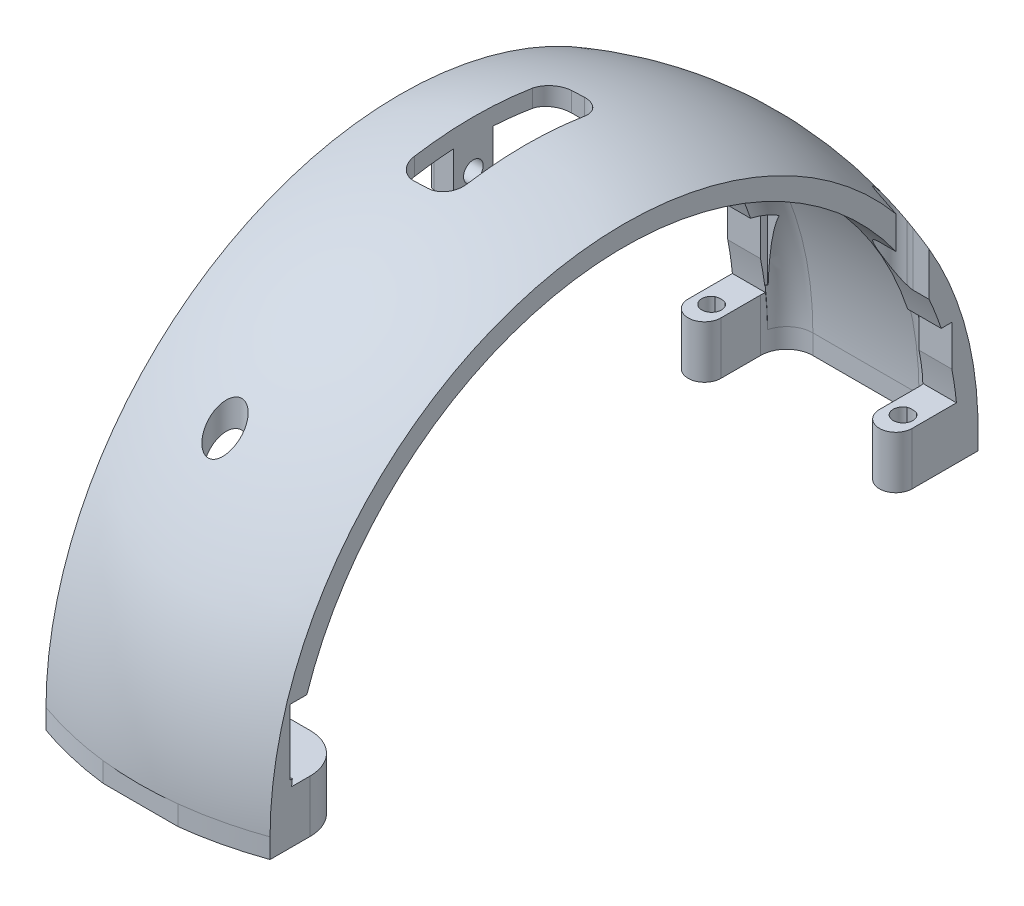
from build123d import *

# Parameters (mm, degrees)
BOSS_EXTRUDE1_DEPTH      = 2
REVOLVE6_ANGLE           = 180
CUT_EXTRUDE1_START       = 20.742633116
CUT_EXTRUDE1_OUTLINE_R   = 2.5
CUT_EXTRUDE1_DEPTH       = 21.257366884
BOSS_EXTRUDE2_DEPTH      = 2
BOSS_EXTRUDE2_DEPTH_BACK = 3
SKETCH1_11_R             = 1.5
BOSS_EXTRUDE3_START      = -3
SKETCH1_12_R             = 1.5
BOSS_EXTRUDE3_DEPTH      = 3
CUT_EXTRUDE2_DEPTH       = 70
BOSS_EXTRUDE5_START      = 47
BOSS_EXTRUDE5_DEPTH      = 7.045906413
SKETCH4_R                = 1.5
CUT_EXTRUDE3_DEPTH       = 16
CUT_EXTRUDE4_START       = -16
SKETCH4_3_R              = 1.5
CUT_EXTRUDE4_DEPTH       = 3
CUT_EXTRUDE5_START       = 6
SKETCH1_16_W             = 5
SKETCH1_16_H             = 2.29
CUT_EXTRUDE5_DEPTH       = 10
BOSS_EXTRUDE6_START      = 2
SKETCH1_17_R             = 1.5
BOSS_EXTRUDE6_DEPTH      = 3
BOSS_EXTRUDE7_START      = 12.7
BOSS_EXTRUDE7_DEPTH      = 12.7
BOSS_EXTRUDE8_DEPTH      = 16.51
BOSS_EXTRUDE9_DEPTH      = 3
CUT_EXTRUDE6_DEPTH       = 4
BOSS_EXTRUDE10_DEPTH     = 3
CUT_EXTRUDE8_REACH       = 81.497
CUT_EXTRUDE9_REACH       = 81.497
FILLET8_R                = 6


with BuildPart() as part:
    # Sketch1 → Boss-Extrude1 (new body)
    with BuildSketch(Plane(origin=(0, 0, 0), x_dir=(1, 0, 0), z_dir=(0, 1, 0))):
        with BuildLine():
            ThreePointArc((14.01, 44), (16.51, 41.5), (19.01, 44))
            Line((19.01, 44), (19.01, 54.045906413))
            add(Edge.make_bspline(
                [(-15.2, 54.045906413), (1.905, 60.045906413), (19.01, 54.045906413)],
                knots=[0, 0, 0, 1, 1, 1], degree=2))
            Line((-15.2, 54.045906413), (-15.2, 44))
            ThreePointArc((-15.2, 44), (-12.7, 41.5), (-10.2, 44))
            Line((-10.2, 44), (-10.2, 50.045906413))
            ThreePointArc((-10.2, 50.045906413), (-9.028427125, 52.874333538), (-6.2, 54.045906413))
            Line((-6.2, 54.045906413), (10.01, 54.045906413))
            ThreePointArc((10.01, 54.045906413), (12.838427125, 52.874333538), (14.01, 50.045906413))
            Line((14.01, 50.045906413), (14.01, 44))
        make_face()
        with BuildLine():
            ThreePointArc((-13.48093473, 46.374898092), (-12.711256934, 46.499974656), (-11.940483977, 46.381834463))
            ThreePointArc((-11.940483977, 46.381834463), (-12.698159473, 43.59125008), (-13.48093473, 46.374898092))
        make_face(mode=Mode.SUBTRACT)
        with BuildLine():
            ThreePointArc((17.281951224, 46.377833322), (16.501139826, 43.578706806), (15.838703064, 46.408186127))
            ThreePointArc((15.838703064, 46.408186127), (16.562565622, 46.49944731), (17.281951224, 46.377833322))
        make_face(mode=Mode.SUBTRACT)
    extrude(amount=BOSS_EXTRUDE1_DEPTH)

    # Revolve6: read off the stored shape, not the designer's step
    # Revolve6 outline → Revolve6 (revolve)
    with BuildSketch(Plane(origin=(0, 0, 0), x_dir=(0, 0, -1), z_dir=(0, -1, 0))):
        with BuildLine():
            Line((54.045906413, 10.01), (54.045906413, -6.2))
            ThreePointArc((54.045906413, -6.2), (53.193633716, -8.668159806), (51, -10.084547004))
            Line((51, -10.084547004), (51, -15.2))
            Line((51, -15.2), (54.045906413, -15.2))
            add(Edge.make_bspline(
                [(54.045906413, -15.2), (60.045906413, 1.905), (54.045906413, 19.01)],
                knots=[0, 0, 0, 1, 1, 1], degree=2))
            Line((54.045906413, 19.01), (51, 19.01))
            Line((51, 19.01), (51, 13.894547004))
            ThreePointArc((51, 13.894547004), (53.193633716, 12.478159806), (54.045906413, 10.01))
        make_face()
    revolve(axis=Axis((0, 0, 0), (1, 0, 0)), revolution_arc=REVOLVE6_ANGLE)

    # Cut-Extrude1: read off the stored shape, not the designer's step
    # Cut-Extrude1 outline → Cut-Extrude1 (cut)
    with BuildSketch(Plane(origin=(0, 0, 0), x_dir=(1, 0, 0), z_dir=(0, 1, 0)).offset(CUT_EXTRUDE1_START)):
        with BuildLine():
            ThreePointArc((15.838703064, 46.408186127), (14.033059819, 43.661226711), (16.51, 41.5))
            Line((16.51, 41.5), (19.01, 41.5))
            Line((19.01, 41.5), (19.01, 44))
            ThreePointArc((19.01, 44), (18.532359768, 45.469714588), (17.281951224, 46.377833322))
            ThreePointArc((17.281951224, 46.377833322), (16.564219778, 46.578043552), (15.838703064, 46.408186127))
        make_face()
        with BuildLine():
            ThreePointArc((-13.48093473, 46.374898092), (-14.725134171, 45.46588935), (-15.2, 44))
            Line((-15.2, 44), (-15.2, 41.5))
            Line((-15.2, 41.5), (-12.7, 41.5))
            ThreePointArc((-12.7, 41.5), (-10.229718016, 43.615673419), (-11.940483977, 46.381834463))
            ThreePointArc((-11.940483977, 46.381834463), (-12.711666745, 46.591219672), (-13.48093473, 46.374898092))
        make_face()
        with Locations((0, -41.91)):
            Circle(CUT_EXTRUDE1_OUTLINE_R)
    extrude(amount=CUT_EXTRUDE1_DEPTH, mode=Mode.SUBTRACT)



with BuildPart() as body_2:
    # Sketch1<11> → Boss-Extrude2 (new, two sides: drawn at the far end of the back side and taken through both)
    with BuildSketch(Plane(origin=(0, 0, 0), x_dir=(1, 0, 0), z_dir=(0, 1, 0)).offset(-BOSS_EXTRUDE2_DEPTH_BACK)):
        with BuildLine():
            Line((-2.5, -41.91), (-2.5, -56.71))
            Line((-2.5, -56.71), (2.5, -56.71))
            Line((2.5, -56.71), (2.5, -41.91))
            ThreePointArc((2.5, -41.91), (0, -39.41), (-2.5, -41.91))
        make_face()
        with Locations(Location((0, -41.91, 0), (0, 0, 270))):
            Circle(SKETCH1_11_R, mode=Mode.SUBTRACT)
    extrude(amount=BOSS_EXTRUDE2_DEPTH + BOSS_EXTRUDE2_DEPTH_BACK)


with BuildPart() as part_1:
    add(part.part)

    add(body_2.part)  # Boss-Extrude3 merges body 2
    # Sketch1<12> → Boss-Extrude3 (add)
    with BuildSketch(Plane(origin=(0, 0, 0), x_dir=(1, 0, 0), z_dir=(0, 1, 0)).offset(BOSS_EXTRUDE3_START)):
        with BuildLine():
            ThreePointArc((14.01, 44), (16.51, 41.5), (19.01, 44))
            Line((19.01, 44), (19.01, 54.045906413))
            add(Edge.make_bspline(
                [(-15.2, 54.045906413), (1.905, 60.045906413), (19.01, 54.045906413)],
                knots=[0, 0, 0, 1, 1, 1], degree=2))
            Line((-15.2, 54.045906413), (-15.2, 44))
            ThreePointArc((-15.2, 44), (-12.7, 41.5), (-10.2, 44))
            Line((-10.2, 44), (-10.2, 50.045906413))
            ThreePointArc((-10.2, 50.045906413), (-9.028427125, 52.874333538), (-6.2, 54.045906413))
            Line((-6.2, 54.045906413), (10.01, 54.045906413))
            ThreePointArc((10.01, 54.045906413), (12.838427125, 52.874333538), (14.01, 50.045906413))
            Line((14.01, 50.045906413), (14.01, 44))
        make_face()
        with BuildLine():
            ThreePointArc((17.281951224, 46.377833322), (16.501139826, 43.578706806), (15.838703064, 46.408186127))
            ThreePointArc((15.838703064, 46.408186127), (16.562565622, 46.49944731), (17.281951224, 46.377833322))
        make_face(mode=Mode.SUBTRACT)
        with Locations(Location((-12.704913633, 45.091234874, 0), (0, 0, 59.361493814))):
            Circle(SKETCH1_12_R, mode=Mode.SUBTRACT)
    extrude(amount=BOSS_EXTRUDE3_DEPTH)

    # Sketch1<13> → Cut-Extrude2 (cut)
    with BuildSketch(Plane(origin=(0, 0, 0), x_dir=(1, 0, 0), z_dir=(0, 1, 0))):
        with BuildLine():
            Line((-1, 12), (1, 12))
            ThreePointArc((1, 12), (3.121320344, 11.121320344), (4, 9))
            Line((4, 9), (4, -9))
            ThreePointArc((4, -9), (3.121320344, -11.121320344), (1, -12))
            Line((1, -12), (-1, -12))
            ThreePointArc((-1, -12), (-3.121320344, -11.121320344), (-4, -9))
            Line((-4, -9), (-4, 9))
            ThreePointArc((-4, 9), (-3.121320344, 11.121320344), (-1, 12))
        make_face()
    extrude(amount=CUT_EXTRUDE2_DEPTH, mode=Mode.SUBTRACT)

    # Boss-Extrude5: read off the stored shape, not the designer's step
    # Boss-Extrude5 outline → Boss-Extrude5 (add)
    with BuildSketch(Plane(origin=(0, 0, 0), x_dir=(1, 0, 0), z_dir=(0, 1, 0)).offset(BOSS_EXTRUDE5_START)):
        with BuildLine():
            Line((-7, -3), (-4, -3))
            Line((-4, -3), (-4, 3))
            Line((-4, 3), (-7, 3))
            ThreePointArc((-7, 3), (-7.707106782, 2.707106781), (-8, 1.999999999))
            Line((-8, 1.999999999), (-8, -1.999999999))
            ThreePointArc((-8, -1.999999999), (-7.707106782, -2.707106781), (-7, -3))
        make_face()
        with BuildLine():
            Line((4, 3), (4, -3))
            Line((4, -3), (7, -3))
            ThreePointArc((7, -3), (7.707106781, -2.707106781), (8, -2))
            Line((8, -2), (8, 1.999999996))
            ThreePointArc((8, 1.999999996), (7.707106783, 2.70710678), (7, 3))
            Line((7, 3), (4, 3))
        make_face()
    extrude(amount=BOSS_EXTRUDE5_DEPTH)

    # Sketch4 → Cut-Extrude3 (cut)
    with BuildSketch(Plane(origin=(8, 0, 0), x_dir=(0, 0, -1), z_dir=(1, 0, 0))):
        with Locations((0, 49.5)):
            Circle(SKETCH4_R)
    extrude(amount=-CUT_EXTRUDE3_DEPTH, mode=Mode.SUBTRACT)

    # Sketch4<3> → Cut-Extrude4 (cut)
    # profile 1 of 4: a face of its own
    with BuildSketch(Plane(origin=(8, 0, 0), x_dir=(0, 0, -1), z_dir=(1, 0, 0)).offset(CUT_EXTRUDE4_START)):
        Polygon((-1.47589923, 47.056332453), (1.37832856, 47), (2, 48.029310331), (2, 50.993058263), (1.47589923, 51.943667547), (-1.37832856, 52), (-2, 50.970689669), (-2, 48.006941737), align=None)
        with Locations((0, 49.5)):
            Circle(SKETCH4_3_R, mode=Mode.SUBTRACT)
    # profile 2 of 4: a face of its own
    with BuildSketch(Plane(origin=(8, 0, 0), x_dir=(0, 0, -1), z_dir=(1, 0, 0)).offset(CUT_EXTRUDE4_START)):
        Polygon((-2.854227789, 49.556332453), (-2, 48.006941737), (-2, 50.970689669), align=None)
    # profile 3 of 4: a face of its own
    with BuildSketch(Plane(origin=(8, 0, 0), x_dir=(0, 0, -1), z_dir=(1, 0, 0)).offset(CUT_EXTRUDE4_START)):
        Polygon((2, 50.993058263), (2, 48.029310331), (2.854227789, 49.443667547), align=None)
    # profile 4 of 4: a face of its own
    with BuildSketch(Plane(origin=(8, 0, 0), x_dir=(0, 0, -1), z_dir=(1, 0, 0)).offset(CUT_EXTRUDE4_START)):
        with Locations((0, 49.5)):
            Circle(SKETCH4_3_R)
    extrude(amount=-CUT_EXTRUDE4_DEPTH, mode=Mode.SUBTRACT)

    # Sketch1<16> → Cut-Extrude5 (cut)
    with BuildSketch(Plane(origin=(0, 0, 0), x_dir=(1, 0, 0), z_dir=(0, 1, 0)).offset(CUT_EXTRUDE5_START)):
        with BuildLine():
            Line((-21, 0), (-16, 0))
            Line((-16, 0), (-8, 0))
            Line((-8, 0), (-8, 2))
            ThreePointArc((-8, 2), (-7.707106781, 2.707106781), (-7, 3))
            Line((-7, 3), (-4, 3))
            Line((-4, 3), (-4, 9))
            ThreePointArc((-4, 9), (-3.121320344, 11.121320344), (-1, 12))
            Line((-1, 12), (1, 12))
            ThreePointArc((1, 12), (3.121320344, 11.121320344), (4, 9))
            Line((4, 9), (4, 3))
            Line((4, 3), (7, 3))
            ThreePointArc((7, 3), (7.707106781, 2.707106781), (8, 2))
            Line((8, 2), (8, 0))
            Line((8, 0), (35, 0))
            Line((35, 0), (35, 51))
            Line((35, 51), (19.01, 51))
            Line((19.01, 51), (19.01, 50.045906413))
            Line((19.01, 50.045906413), (19.01, 44))
            Line((19.01, 44), (19.01, 41.5))
            Line((19.01, 41.5), (16.51, 41.5))
            ThreePointArc((16.51, 41.5), (14.742233047, 42.232233047), (14.01, 44))
            Line((14.01, 44), (14.01, 50.045906413))
            ThreePointArc((14.01, 50.045906413), (13.981031857, 50.526433199), (13.894547004, 51))
            Line((13.894547004, 51), (-10.084547004, 51))
            ThreePointArc((-10.084547004, 51), (-10.171031857, 50.526433199), (-10.2, 50.045906413))
            Line((-10.2, 50.045906413), (-10.2, 44))
            ThreePointArc((-10.2, 44), (-10.932233047, 42.232233047), (-12.7, 41.5))
            Line((-12.7, 41.5), (-15.2, 41.5))
            Line((-15.2, 41.5), (-15.2, 44))
            Line((-15.2, 44), (-15.2, 50.045906413))
            Line((-15.2, 50.045906413), (-15.2, 51))
            Line((-15.2, 51), (-35, 51))
            Line((-35, 51), (-35, 0))
            Line((-35, 0), (-21, 0))
        make_face()
        with BuildLine():
            Line((19.01, 50.045906413), (14.01, 50.045906413))
            Line((14.01, 50.045906413), (14.01, 44))
            ThreePointArc((14.01, 44), (14.518989912, 45.511912309), (15.838703064, 46.408186127))
            ThreePointArc((15.838703064, 46.408186127), (16.564218572, 46.578043578), (17.281951224, 46.377833322))
            ThreePointArc((17.281951224, 46.377833322), (18.532359768, 45.469714588), (19.01, 44))
            Line((19.01, 44), (19.01, 50.045906413))
        make_face()
        with BuildLine():
            Line((-10.2, 50.045906413), (-15.2, 50.045906413))
            Line((-15.2, 50.045906413), (-15.2, 44))
            ThreePointArc((-15.2, 44), (-14.725134171, 45.46588935), (-13.48093473, 46.374898092))
            ThreePointArc((-13.48093473, 46.374898092), (-12.711667794, 46.591219668), (-11.940483977, 46.381834463))
            ThreePointArc((-11.940483977, 46.381834463), (-10.681486926, 45.474993211), (-10.2, 44))
            Line((-10.2, 44), (-10.2, 50.045906413))
        make_face()
        with BuildLine():
            Line((-8, 0), (-16, 0))
            Line((-16, 0), (-21, 0))
            Line((-21, 0), (-35, 0))
            Line((-35, 0), (-35, -51))
            Line((-35, -51), (-2.5, -51))
            Line((-2.5, -51), (-2.5, -48.71))
            Line((-2.5, -48.71), (-2.5, -41.91))
            ThreePointArc((-2.5, -41.91), (0, -39.41), (2.5, -41.91))
            Line((2.5, -41.91), (2.5, -48.71))
            Line((2.5, -48.71), (2.5, -51))
            Line((2.5, -51), (35, -51))
            Line((35, -51), (35, 0))
            Line((35, 0), (8, 0))
            Line((8, 0), (8, -2))
            ThreePointArc((8, -2), (7.707106781, -2.707106781), (7, -3))
            Line((7, -3), (4, -3))
            Line((4, -3), (4, -9))
            ThreePointArc((4, -9), (3.121320344, -11.121320344), (1, -12))
            Line((1, -12), (-1, -12))
            ThreePointArc((-1, -12), (-3.121320344, -11.121320344), (-4, -9))
            Line((-4, -9), (-4, -3))
            Line((-4, -3), (-7, -3))
            ThreePointArc((-7, -3), (-7.707106781, -2.707106781), (-8, -2))
            Line((-8, -2), (-8, 0))
        make_face()
        with BuildLine():
            Line((-2.5, -41.91), (-2.5, -48.71))
            Line((-2.5, -48.71), (2.5, -48.71))
            Line((2.5, -48.71), (2.5, -41.91))
            ThreePointArc((2.5, -41.91), (0, -44.41), (-2.5, -41.91))
        make_face()
        with Locations((0, -49.855)):
            Rectangle(SKETCH1_16_W, SKETCH1_16_H)
    extrude(amount=CUT_EXTRUDE5_DEPTH, mode=Mode.SUBTRACT)

    # Sketch1<17> → Boss-Extrude6 (add)
    # profile 1 of 3: a face of its own
    with BuildSketch(Plane(origin=(0, 0, 0), x_dir=(1, 0, 0), z_dir=(0, 1, 0)).offset(BOSS_EXTRUDE6_START)):
        with BuildLine():
            ThreePointArc((-15.2, 44), (-12.7, 41.5), (-10.2, 44))
            Line((-10.2, 44), (-10.2, 50.045906413))
            Line((-10.2, 50.045906413), (-15.2, 50.045906413))
            Line((-15.2, 50.045906413), (-15.2, 44))
        make_face()
        with BuildLine():
            ThreePointArc((-13.48093473, 46.374898092), (-12.711256934, 46.499974656), (-11.940483977, 46.381834463))
            ThreePointArc((-11.940483977, 46.381834463), (-12.698159473, 43.59125008), (-13.48093473, 46.374898092))
        make_face(mode=Mode.SUBTRACT)
    # profile 2 of 3: a face of its own
    with BuildSketch(Plane(origin=(0, 0, 0), x_dir=(1, 0, 0), z_dir=(0, 1, 0)).offset(BOSS_EXTRUDE6_START)):
        with BuildLine():
            Line((-2.5, -41.91), (-2.5, -48.71))
            Line((-2.5, -48.71), (2.5, -48.71))
            Line((2.5, -48.71), (2.5, -41.91))
            ThreePointArc((2.5, -41.91), (0, -39.41), (-2.5, -41.91))
        make_face()
        with Locations((0, -41.91)):
            Circle(SKETCH1_17_R, mode=Mode.SUBTRACT)
    # profile 3 of 3: a face of its own
    with BuildSketch(Plane(origin=(0, 0, 0), x_dir=(1, 0, 0), z_dir=(0, 1, 0)).offset(BOSS_EXTRUDE6_START)):
        with BuildLine():
            ThreePointArc((14.01, 44), (16.51, 41.5), (19.01, 44))
            Line((19.01, 44), (19.01, 50.045906413))
            Line((19.01, 50.045906413), (14.01, 50.045906413))
            Line((14.01, 50.045906413), (14.01, 44))
        make_face()
        with BuildLine():
            ThreePointArc((17.281951224, 46.377833322), (16.501139826, 43.578706806), (15.838703064, 46.408186127))
            ThreePointArc((15.838703064, 46.408186127), (16.562565622, 46.49944731), (17.281951224, 46.377833322))
        make_face(mode=Mode.SUBTRACT)
    extrude(amount=BOSS_EXTRUDE6_DEPTH)

    # Sketch5 → Boss-Extrude7 (add)
    with BuildSketch(Plane.ZY.offset(2.5).offset(BOSS_EXTRUDE7_START)):
        with BuildLine():
            Line((56.71, 0), (54.045906413, 0))
            ThreePointArc((54.045906413, 0), (54.036651057, 1.000171279), (54.008888157, 2))
            Line((54.008888157, 2), (48.71, 2))
            Line((48.71, 2), (48.71, 5))
            Line((48.71, 5), (41.91, 5))
            Line((41.91, 5), (41.91, -3))
            Line((41.91, -3), (56.71, -3))
            Line((56.71, -3), (56.71, 0))
        make_face()
    extrude(amount=-BOSS_EXTRUDE7_DEPTH)

    # Sketch6 → Boss-Extrude8 (add)
    with BuildSketch(Plane(origin=(2.5, 0, 0), x_dir=(0, 0, -1), z_dir=(1, 0, 0))):
        with BuildLine():
            Line((-41.91, 5), (-48.71, 5))
            Line((-48.71, 5), (-48.71, 2))
            Line((-48.71, 2), (-54.008888157, 2))
            ThreePointArc((-54.008888157, 2), (-54.036651057, 1.000171279), (-54.045906413, 0))
            Line((-54.045906413, 0), (-56.71, 0))
            Line((-56.71, 0), (-56.71, -3))
            Line((-56.71, -3), (-41.91, -3))
            Line((-41.91, -3), (-41.91, 5))
        make_face()
    extrude(amount=BOSS_EXTRUDE8_DEPTH)

    # Sketch7 → Boss-Extrude9 (add)
    with BuildSketch(Plane(origin=(0, 2, 0), x_dir=(1, 0, 0), z_dir=(0, 1, 0))):
        with BuildLine():
            Line((19.01, -48.71), (-15.2, -48.71))
            Line((-15.2, -48.71), (-15.2, -50.960769225))
            Line((-15.2, -50.960769225), (-10.084547004, -50.960769225))
            add(Edge.make_bspline(
                [(-10.084547004, -50.960769225), (-10.031802317, -51.175682047), (-9.960099486, -51.389294712), (-9.784457302, -51.796370976), (-9.680543569, -51.991061098), (-9.440721293, -52.36285005), (-9.303315568, -52.541347163), (-9.004337698, -52.869006649), (-8.842563037, -53.019134374), (-8.494645203, -53.292212119), (-8.306584474, -53.416045818), (-7.916835023, -53.628252222), (-7.714885401, -53.717324786), (-7.296987096, -53.86177149), (-7.078906779, -53.917380518), (-6.64100805, -53.990683357), (-6.421017696, -54.008888157), (-6.2, -54.008888157)],
                knots=[0, 0, 0, 0, 0.125, 0.125, 0.25, 0.25, 0.375, 0.375, 0.5, 0.5, 0.625, 0.625, 0.75, 0.75, 0.875, 0.875, 1, 1, 1, 1], degree=3))
            Line((-6.2, -54.008888157), (10.01, -54.008888157))
            add(Edge.make_bspline(
                [(10.01, -54.008888157), (10.231238763, -54.008888157), (10.455750582, -53.990140996), (10.893075531, -53.916425981), (11.106902051, -53.861800586), (11.524960759, -53.717299039), (11.730958914, -53.626289909), (12.120409272, -53.413674484), (12.304675456, -53.292187413), (12.652511286, -53.019175953), (12.817426699, -52.865988108), (13.116292836, -52.537709967), (13.250815409, -52.362702468), (13.490431593, -51.991236368), (13.596278193, -51.792768408), (13.771804823, -51.384712216), (13.841881163, -51.175360783), (13.894547004, -50.960769225)],
                knots=[0, 0, 0, 0, 0.125, 0.125, 0.25, 0.25, 0.375, 0.375, 0.5, 0.5, 0.625, 0.625, 0.75, 0.75, 0.875, 0.875, 1, 1, 1, 1], degree=3))
            Line((13.894547004, -50.960769225), (19.01, -50.960769225))
            Line((19.01, -50.960769225), (19.01, -48.71))
        make_face()
    extrude(amount=BOSS_EXTRUDE9_DEPTH)

    # Sketch9 → Cut-Extrude6 (cut)
    with BuildSketch(Plane(origin=(0, 0, 0), x_dir=(1, 0, 0), z_dir=(0, 1, 0))):
        with BuildLine():
            Line((7.628630631, -56.709999999), (19.01, -56.71))
            Line((19.01, -56.71), (19.009999932, -54.045906437))
            add(Edge.make_bspline(
                [(19.009999932, -54.045906437), (13.319315281, -56.042054216), (7.628630631, -56.709999999)],
                knots=[0, 0, 0, 1, 1, 1], degree=2))
        make_face()
        with BuildLine():
            Line((-15.200000002, -54.045906412), (-15.2, -56.71))
            Line((-15.2, -56.71), (-3.818630631, -56.709999999))
            add(Edge.make_bspline(
                [(-3.818630631, -56.709999999), (-9.509315316, -56.042054212), (-15.200000002, -54.045906412)],
                knots=[0, 0, 0, 1, 1, 1], degree=2))
        make_face()
    extrude(amount=-CUT_EXTRUDE6_DEPTH, mode=Mode.SUBTRACT)

    # Sketch10 → Boss-Extrude10 (add)
    with BuildSketch(Plane(origin=(0, 2, 0), x_dir=(1, 0, 0), z_dir=(0, 1, 0))):
        with BuildLine():
            Line((14.01, 50.045906413), (19.01, 50.045906413))
            Line((19.01, 50.045906413), (19.01, 50.960769225))
            Line((19.01, 50.960769225), (13.90397304, 50.960769225))
            ThreePointArc((13.90397304, 50.960769225), (13.983404847, 50.50639954), (14.01, 50.045906413))
        make_face()
        with BuildLine():
            Line((-15.2, 50.045906413), (-10.2, 50.045906413))
            ThreePointArc((-10.2, 50.045906413), (-10.173404847, 50.50639954), (-10.09397304, 50.960769225))
            Line((-10.09397304, 50.960769225), (-15.2, 50.960769225))
            Line((-15.2, 50.960769225), (-15.2, 50.045906413))
        make_face()
    extrude(amount=BOSS_EXTRUDE10_DEPTH)

    # Sketch12 → Cut-Extrude8 (cut, up to next)
    with BuildSketch(Plane(origin=(0, 5, 0), x_dir=(1, 0, 0), z_dir=(0, 1, 0)), mode=Mode.PRIVATE) as cut_extrude8_sk1:
        with BuildLine():
            Line((19.01, 46.578043578), (16.564218572, 46.578043578))
            ThreePointArc((16.564218572, 46.578043578), (16.935714739, 46.523215098), (17.281951224, 46.377833322))
            ThreePointArc((17.281951224, 46.377833322), (18.532359768, 45.469714588), (19.01, 44))
            Line((19.01, 44), (19.01, 46.578043578))
        make_face()
    cut_extrude8_tool1 = extrude(cut_extrude8_sk1.sketch, amount=CUT_EXTRUDE8_REACH, mode=Mode.PRIVATE) & part_1.part
    add(cut_extrude8_tool1.solids().sort_by_distance((18.408473, 5, -46.003368))[0], mode=Mode.SUBTRACT)

    # Sketch13 → Cut-Extrude9 (cut, up to next)
    with BuildSketch(Plane(origin=(0, 5, 0), x_dir=(1, 0, 0), z_dir=(0, 1, 0)), mode=Mode.PRIVATE) as cut_extrude9_sk1:
        with BuildLine():
            ThreePointArc((-13.48093473, 46.374898092), (-13.11097155, 46.535228284), (-12.711667794, 46.591219668))
            Line((-12.711667794, 46.591219668), (-15.2, 46.591219668))
            Line((-15.2, 46.591219668), (-15.2, 44))
            ThreePointArc((-15.2, 44), (-14.725134171, 45.46588935), (-13.48093473, 46.374898092))
        make_face()
    cut_extrude9_tool1 = extrude(cut_extrude9_sk1.sketch, amount=CUT_EXTRUDE9_REACH, mode=Mode.PRIVATE) & part_1.part
    add(cut_extrude9_tool1.solids().sort_by_distance((-14.591025, 5, -46.013736))[0], mode=Mode.SUBTRACT)

    # Fillet8
    fillet8_edges = [part_1.edges().sort_by_distance(p)[0] for p in [
        (-15.2, 1, 41.91),
        (19.01, 1, 41.91),
    ]]
    fillet(fillet8_edges, radius=FILLET8_R)


solid = part_1.part
